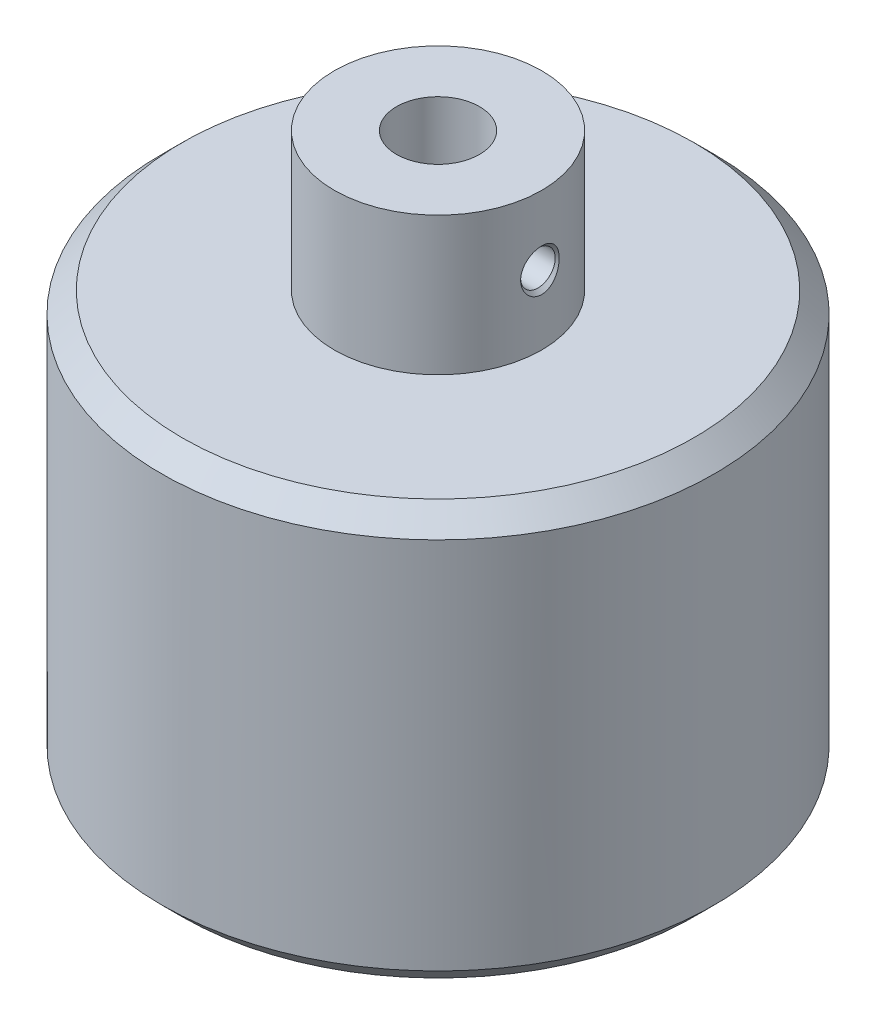
from build123d import *

# Parameters (mm, degrees)
SKETCH2_R           = 20
BOSS_EXTRUDE1_DEPTH = 30
SKETCH6_R           = 7.5
BOSS_EXTRUDE3_DEPTH = 40
SKETCH7_R           = 3
CUT_EXTRUDE1_DEPTH  = 49.989794856
CHAMFER1_SIZE       = 1.5


# Read off the part's stored shape, not the designer's step: M3 Tapped Hole1
with BuildPart() as part:
    # Sketch2 → Boss-Extrude1 (new body)
    with BuildSketch(Plane(origin=(0, 0, 0), x_dir=(1, 0, 0), z_dir=(0, 1, 0))):
        with Locations(Location((0, 0, 0), (0, 0, 270))):
            Circle(SKETCH2_R)
    extrude(amount=BOSS_EXTRUDE1_DEPTH)

    # Sketch6 → Boss-Extrude3 (add)
    with BuildSketch(Plane(origin=(0, 0, 0), x_dir=(1, 0, 0), z_dir=(0, 1, 0))):
        with Locations(Location((0, 0, 0), (0, 0, 270))):
            Circle(SKETCH6_R)
    extrude(amount=BOSS_EXTRUDE3_DEPTH)

    # Sketch7 → Cut-Extrude1 (cut, through all)
    with BuildSketch(Plane(origin=(0, 40, 0), x_dir=(1, 0, 0), z_dir=(0, 1, 0))):
        with Locations(Location((0, 0, 0), (0, 0, 270))):
            Circle(SKETCH7_R)
    extrude(amount=-CUT_EXTRUDE1_DEPTH, mode=Mode.SUBTRACT)

    # M3 Tapped Hole1 outline → M3 Tapped Hole1 (revolve, cut)
    with BuildSketch(Plane(origin=(0, 35, 0), x_dir=(0, 1, 0), z_dir=(0, 0, -1))):
        Polygon((1.525048793, 7.500048793), (0, 7.500048793), (0, 2.72705461), (1.25, 2.72705461), (1.25, 7.225), align=None)
    revolve(axis=Axis((0, 35, 0), (1, 0, 0)), mode=Mode.SUBTRACT)

    # Chamfer1
    chamfer1_edges = [part.edges().sort_by_distance(p)[0] for p in [
        (0, 0, -20),
        (0, 30, -20),
    ]]
    chamfer(chamfer1_edges, length=CHAMFER1_SIZE)


solid = part.part
